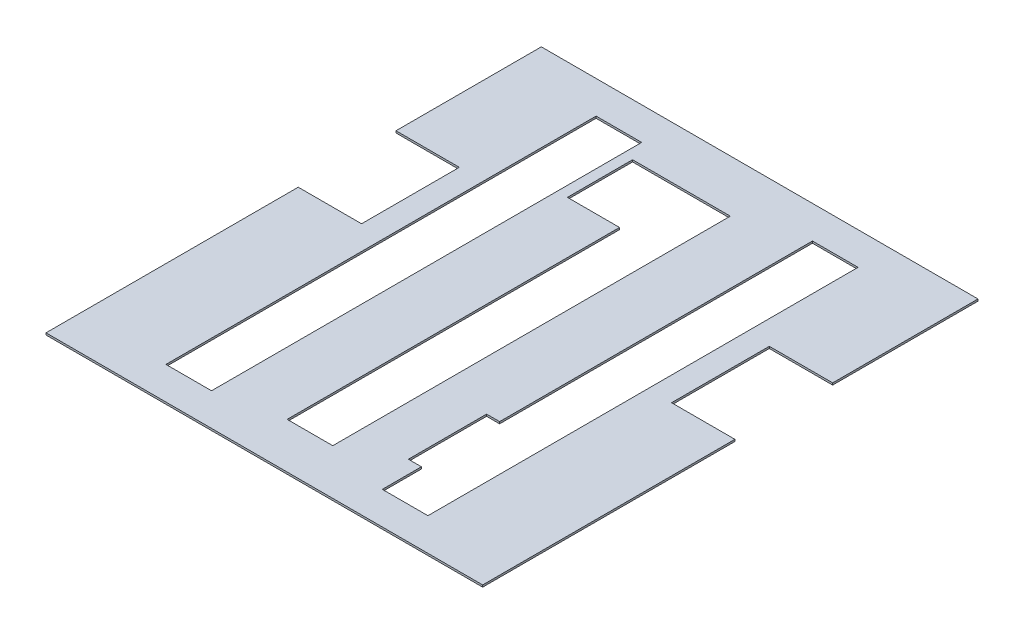
from build123d import *

# Parameters (mm, degrees)
SKETCH1_W           = 335
SKETCH1_H           = 380
BOSS_EXTRUDE1_DEPTH = 1.5
SKETCH2_W           = 48.6
SKETCH2_H           = 75
CUT_EXTRUDE1_DEPTH  = 10
SKETCH3_W           = 35
SKETCH3_H           = 330
CUT_EXTRUDE2_DEPTH  = 10
SKETCH7_W           = 17
SKETCH7_H           = 60
CUT_EXTRUDE5_DEPTH  = 10


with BuildPart() as part:
    # Sketch1 → Boss-Extrude1 (new body)
    with BuildSketch(Plane(origin=(0, 0, 0), x_dir=(1, 0, 0), z_dir=(0, 1, 0))):
        with Locations((6173.584066999, -8762.312377786)):
            Rectangle(SKETCH1_W, SKETCH1_H)
    extrude(amount=BOSS_EXTRUDE1_DEPTH)

    # Sketch2 → Cut-Extrude1 (cut)
    with BuildSketch(Plane(origin=(0, 1.5, 0), x_dir=(1, 0, 0), z_dir=(0, 1, 0))):
        with Locations((6030.384066999, -8721.312377786)):
            Rectangle(SKETCH2_W, SKETCH2_H)
        with Locations((6316.784066999, -8721.312377786)):
            Rectangle(SKETCH2_W, SKETCH2_H)
    extrude(amount=-CUT_EXTRUDE1_DEPTH, mode=Mode.SUBTRACT)

    # Sketch3 → Cut-Extrude2 (cut)
    with BuildSketch(Plane(origin=(0, 1.5, 0), x_dir=(1, 0, 0), z_dir=(0, 1, 0))):
        with Locations((6256.584066999, -8762.312377786)):
            Rectangle(SKETCH3_W, SKETCH3_H)
        Polygon((6156.084066999, -8662.312377786), (6156.084066999, -8917.312377786), (6191.084066999, -8917.312377786), (6191.084066999, -8612.312377786), (6116.084066999, -8612.312377786), (6116.084066999, -8662.312377786), align=None)
        with Locations((6090.584066999, -8762.312377786)):
            Rectangle(SKETCH3_W, SKETCH3_H)
    extrude(amount=-CUT_EXTRUDE2_DEPTH, mode=Mode.SUBTRACT)

    # Sketch7 → Cut-Extrude5 (cut)
    with BuildSketch(Plane(origin=(0, 1.5, 0), x_dir=(1, 0, 0), z_dir=(0, 1, 0))):
        with Locations((6237.584066999, -8867.312377786)):
            Rectangle(SKETCH7_W, SKETCH7_H)
    extrude(amount=-CUT_EXTRUDE5_DEPTH, mode=Mode.SUBTRACT)


solid = part.part
